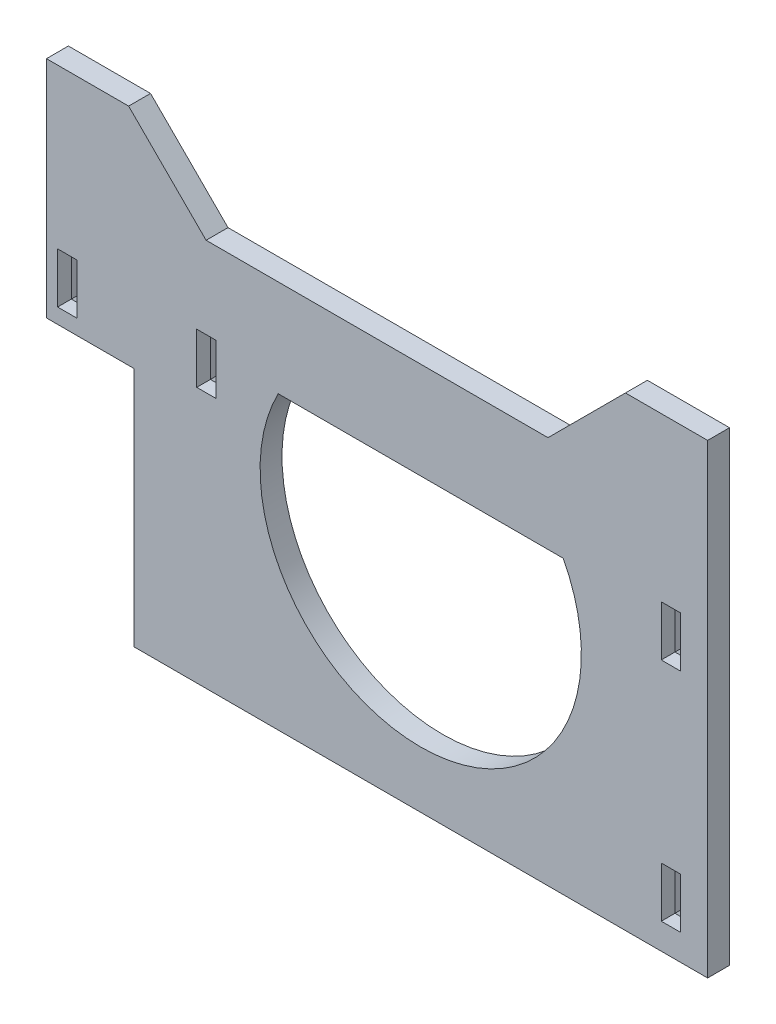
from build123d import *
from OCP.BRepFilletAPI import BRepFilletAPI_MakeChamfer

# Parameters (mm, degrees)
SKETCH1_W           = 3.53
SKETCH1_H           = 9.2
BOSS_EXTRUDE1_DEPTH = 4
BOSS_EXTRUDE2_DEPTH = 4
CHAMFER1_SIZE       = 1.5
CHAMFER1_SIZE2      = 0.5


with BuildPart() as part:
    # Sketch1 → Boss-Extrude1 (new body)
    with BuildSketch(Plane.XY):
        Polygon((52.4925, 30), (52.4925, -30), (-52.2075, -30), (-52.2075, 14), (-68.2075, 14), (-68.2075, 30), align=None)
        with BuildLine():
            Line((-25.900000003, 23.179137901), (26.135555553, 23.179137901))
            ThreePointArc((26.135555553, 23.179137901), (0.117777775, -19.676914391), (-25.900000003, 23.179137901))
        make_face(mode=Mode.SUBTRACT)
        with Locations((-39.0075, 21.35)):
            Rectangle(SKETCH1_W, SKETCH1_H, mode=Mode.SUBTRACT)
        with Locations((45.7925, 20.65)):
            Rectangle(SKETCH1_W, SKETCH1_H, mode=Mode.SUBTRACT)
        with Locations((45.8, -20.65)):
            Rectangle(SKETCH1_W, SKETCH1_H, mode=Mode.SUBTRACT)
        with Locations((-64.4075, 21.35)):
            Rectangle(SKETCH1_W, SKETCH1_H, mode=Mode.SUBTRACT)
    extrude(amount=BOSS_EXTRUDE1_DEPTH)

    # Sketch2 → Boss-Extrude2 (add)
    with BuildSketch(Plane.XY):
        Polygon((-68.2075, 30), (52.4925, 30), (52.4925, 55), (37.4925, 55), (23.350364376, 40.857864376), (-39.065364376, 40.857864376), (-53.2075, 55), (-68.2075, 55), align=None)
    extrude(amount=BOSS_EXTRUDE2_DEPTH)

    # Chamfer1: one chamfer whose edges measure the first distance from different faces: ONE call of the kernel's chamfer builder (chamfer() names one face for all edges)
    chamfer1_edges_1 = [part.edges().sort_by_distance(p)[0] for p in [
        (45.8, -25.25, 0),
    ]]
    chamfer1_side_1 = [part.faces().sort_by_distance(p)[0] for p in [
        (45.8, -25.25, 2),
    ]]
    chamfer1_edges_2 = [part.edges().sort_by_distance(p)[0] for p in [
        (44.035, -20.65, 0),
    ]]
    chamfer1_side_2 = [part.faces().sort_by_distance(p)[0] for p in [
        (44.035, -20.65, 2),
    ]]
    chamfer1_edges_3 = [part.edges().sort_by_distance(p)[0] for p in [
        (45.8, -16.05, 0),
    ]]
    chamfer1_side_3 = [part.faces().sort_by_distance(p)[0] for p in [
        (45.8, -16.05, 2),
    ]]
    chamfer1_edges_4 = [part.edges().sort_by_distance(p)[0] for p in [
        (47.565, -20.65, 0),
    ]]
    chamfer1_side_4 = [part.faces().sort_by_distance(p)[0] for p in [
        (47.565, -20.65, 2),
    ]]
    chamfer1_edges_5 = [part.edges().sort_by_distance(p)[0] for p in [
        (-64.4075, 25.95, 0),
    ]]
    chamfer1_side_5 = [part.faces().sort_by_distance(p)[0] for p in [
        (-64.4075, 25.95, 2),
    ]]
    chamfer1_edges_6 = [part.edges().sort_by_distance(p)[0] for p in [
        (-62.6425, 21.35, 0),
    ]]
    chamfer1_side_6 = [part.faces().sort_by_distance(p)[0] for p in [
        (-62.6425, 21.35, 2),
    ]]
    chamfer1_edges_7 = [part.edges().sort_by_distance(p)[0] for p in [
        (-64.4075, 16.75, 0),
    ]]
    chamfer1_side_7 = [part.faces().sort_by_distance(p)[0] for p in [
        (-64.4075, 16.75, 2),
    ]]
    chamfer1_edges_8 = [part.edges().sort_by_distance(p)[0] for p in [
        (-66.1725, 21.35, 0),
    ]]
    chamfer1_side_8 = [part.faces().sort_by_distance(p)[0] for p in [
        (-66.1725, 21.35, 2),
    ]]
    chamfer1_edges_9 = [part.edges().sort_by_distance(p)[0] for p in [
        (-39.0075, 25.95, 0),
    ]]
    chamfer1_side_9 = [part.faces().sort_by_distance(p)[0] for p in [
        (-39.0075, 25.95, 2),
    ]]
    chamfer1_edges_10 = [part.edges().sort_by_distance(p)[0] for p in [
        (-37.2425, 21.35, 0),
    ]]
    chamfer1_side_10 = [part.faces().sort_by_distance(p)[0] for p in [
        (-37.2425, 21.35, 2),
    ]]
    chamfer1_edges_11 = [part.edges().sort_by_distance(p)[0] for p in [
        (-39.0075, 16.75, 0),
    ]]
    chamfer1_side_11 = [part.faces().sort_by_distance(p)[0] for p in [
        (-39.0075, 16.75, 2),
    ]]
    chamfer1_edges_12 = [part.edges().sort_by_distance(p)[0] for p in [
        (-40.7725, 21.35, 0),
    ]]
    chamfer1_side_12 = [part.faces().sort_by_distance(p)[0] for p in [
        (-40.7725, 21.35, 2),
    ]]
    chamfer1_edges_13 = [part.edges().sort_by_distance(p)[0] for p in [
        (45.7925, 25.25, 0),
    ]]
    chamfer1_side_13 = [part.faces().sort_by_distance(p)[0] for p in [
        (45.7925, 25.25, 2),
    ]]
    chamfer1_edges_14 = [part.edges().sort_by_distance(p)[0] for p in [
        (47.5575, 20.65, 0),
    ]]
    chamfer1_side_14 = [part.faces().sort_by_distance(p)[0] for p in [
        (47.5575, 20.65, 2),
    ]]
    chamfer1_edges_15 = [part.edges().sort_by_distance(p)[0] for p in [
        (45.7925, 16.05, 0),
    ]]
    chamfer1_side_15 = [part.faces().sort_by_distance(p)[0] for p in [
        (45.7925, 16.05, 2),
    ]]
    chamfer1_edges_16 = [part.edges().sort_by_distance(p)[0] for p in [
        (44.0275, 20.65, 0),
    ]]
    chamfer1_side_16 = [part.faces().sort_by_distance(p)[0] for p in [
        (44.0275, 20.65, 2),
    ]]
    chamfer1 = BRepFilletAPI_MakeChamfer(part.part.solid().wrapped)
    for e in chamfer1_edges_1:
        chamfer1.Add(CHAMFER1_SIZE, CHAMFER1_SIZE2, e.wrapped, chamfer1_side_1[0].wrapped)  # the first distance lies on this face
    for e in chamfer1_edges_2:
        chamfer1.Add(CHAMFER1_SIZE, CHAMFER1_SIZE2, e.wrapped, chamfer1_side_2[0].wrapped)  # the first distance lies on this face
    for e in chamfer1_edges_3:
        chamfer1.Add(CHAMFER1_SIZE, CHAMFER1_SIZE2, e.wrapped, chamfer1_side_3[0].wrapped)  # the first distance lies on this face
    for e in chamfer1_edges_4:
        chamfer1.Add(CHAMFER1_SIZE, CHAMFER1_SIZE2, e.wrapped, chamfer1_side_4[0].wrapped)  # the first distance lies on this face
    for e in chamfer1_edges_5:
        chamfer1.Add(CHAMFER1_SIZE, CHAMFER1_SIZE2, e.wrapped, chamfer1_side_5[0].wrapped)  # the first distance lies on this face
    for e in chamfer1_edges_6:
        chamfer1.Add(CHAMFER1_SIZE, CHAMFER1_SIZE2, e.wrapped, chamfer1_side_6[0].wrapped)  # the first distance lies on this face
    for e in chamfer1_edges_7:
        chamfer1.Add(CHAMFER1_SIZE, CHAMFER1_SIZE2, e.wrapped, chamfer1_side_7[0].wrapped)  # the first distance lies on this face
    for e in chamfer1_edges_8:
        chamfer1.Add(CHAMFER1_SIZE, CHAMFER1_SIZE2, e.wrapped, chamfer1_side_8[0].wrapped)  # the first distance lies on this face
    for e in chamfer1_edges_9:
        chamfer1.Add(CHAMFER1_SIZE, CHAMFER1_SIZE2, e.wrapped, chamfer1_side_9[0].wrapped)  # the first distance lies on this face
    for e in chamfer1_edges_10:
        chamfer1.Add(CHAMFER1_SIZE, CHAMFER1_SIZE2, e.wrapped, chamfer1_side_10[0].wrapped)  # the first distance lies on this face
    for e in chamfer1_edges_11:
        chamfer1.Add(CHAMFER1_SIZE, CHAMFER1_SIZE2, e.wrapped, chamfer1_side_11[0].wrapped)  # the first distance lies on this face
    for e in chamfer1_edges_12:
        chamfer1.Add(CHAMFER1_SIZE, CHAMFER1_SIZE2, e.wrapped, chamfer1_side_12[0].wrapped)  # the first distance lies on this face
    for e in chamfer1_edges_13:
        chamfer1.Add(CHAMFER1_SIZE, CHAMFER1_SIZE2, e.wrapped, chamfer1_side_13[0].wrapped)  # the first distance lies on this face
    for e in chamfer1_edges_14:
        chamfer1.Add(CHAMFER1_SIZE, CHAMFER1_SIZE2, e.wrapped, chamfer1_side_14[0].wrapped)  # the first distance lies on this face
    for e in chamfer1_edges_15:
        chamfer1.Add(CHAMFER1_SIZE, CHAMFER1_SIZE2, e.wrapped, chamfer1_side_15[0].wrapped)  # the first distance lies on this face
    for e in chamfer1_edges_16:
        chamfer1.Add(CHAMFER1_SIZE, CHAMFER1_SIZE2, e.wrapped, chamfer1_side_16[0].wrapped)  # the first distance lies on this face
    add(Compound.cast(chamfer1.Shape()), mode=Mode.REPLACE)


solid = part.part
